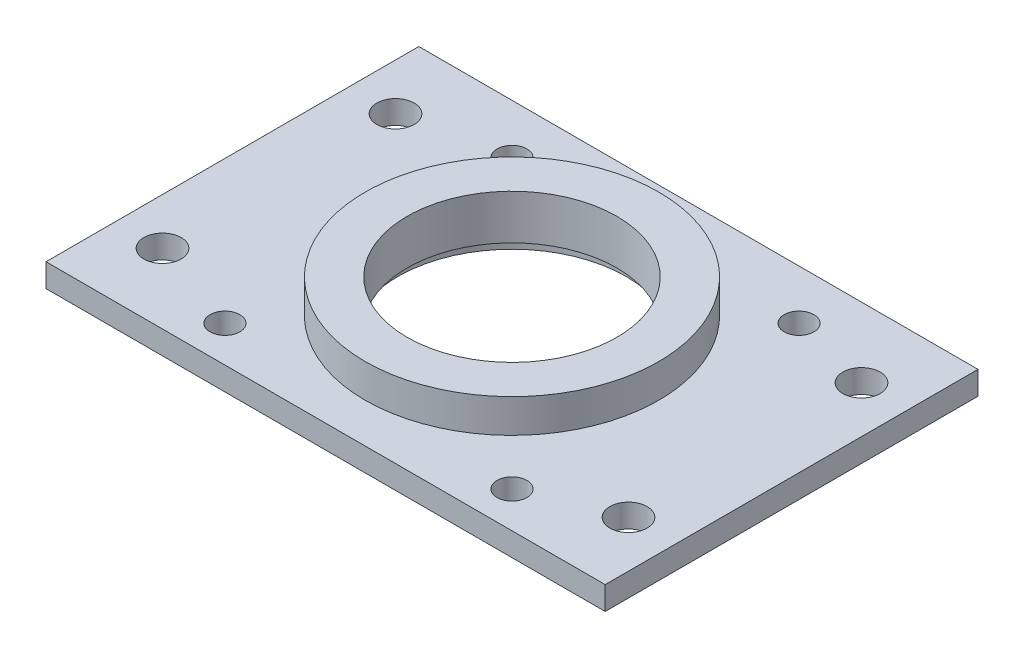
from build123d import *

# Parameters (mm, degrees)
SKETCH1_R           = 20.0025
SKETCH1_R_2         = 14.2875
BOSS_EXTRUDE1_DEPTH = 4.572
BOSS_EXTRUDE2_START = 3.175
SKETCH2_W           = 76.2
SKETCH2_H           = 50.8
SKETCH2_R           = 14.2875
BOSS_EXTRUDE2_DEPTH = 3.175
SKETCH3_R           = 15.5575
CUT_EXTRUDE1_DEPTH  = 1.651
SKETCH5_R           = 2.032
SKETCH5_R_2         = 2.54
CUT_EXTRUDE2_DEPTH  = 47.018183189


with BuildPart() as part:
    # Sketch1 → Boss-Extrude1 (new body)
    with BuildSketch(Plane(origin=(0, 0, 0), x_dir=(1, 0, 0), z_dir=(0, 1, 0))):
        Circle(SKETCH1_R)
        Circle(SKETCH1_R_2, mode=Mode.SUBTRACT)
    extrude(amount=BOSS_EXTRUDE1_DEPTH)

    # Sketch2 → Boss-Extrude2 (add)
    with BuildSketch(Plane.XZ.offset(BOSS_EXTRUDE2_START)):
        Rectangle(SKETCH2_W, SKETCH2_H)
        Circle(SKETCH2_R, mode=Mode.SUBTRACT)
    extrude(amount=-BOSS_EXTRUDE2_DEPTH)

    # Sketch3 → Cut-Extrude1 (cut)
    with BuildSketch(Plane.XZ.offset(3.175)):
        Circle(SKETCH3_R)
    extrude(amount=-CUT_EXTRUDE1_DEPTH, mode=Mode.SUBTRACT)

    # Sketch5 → Cut-Extrude2 (cut, through all)
    with BuildSketch(Plane(origin=(0, 0, 0), x_dir=(1, 0, 0), z_dir=(0, 1, 0))):
        with Locations((-18.64995, 18.64995)):
            Circle(SKETCH5_R)
        with Locations((20.46605, 18.64995)):
            Circle(SKETCH5_R)
        with Locations((-18.64995, -20.46605)):
            Circle(SKETCH5_R)
        with Locations((20.46605, -20.46605)):
            Circle(SKETCH5_R)
        with Locations((-31.75, 15.875)):
            Circle(SKETCH5_R_2)
        with Locations((31.75, 15.875)):
            Circle(SKETCH5_R_2)
        with Locations((31.75, -15.875)):
            Circle(SKETCH5_R_2)
        with Locations((-31.75, -15.875)):
            Circle(SKETCH5_R_2)
    extrude(amount=-CUT_EXTRUDE2_DEPTH, mode=Mode.SUBTRACT)


solid = part.part
